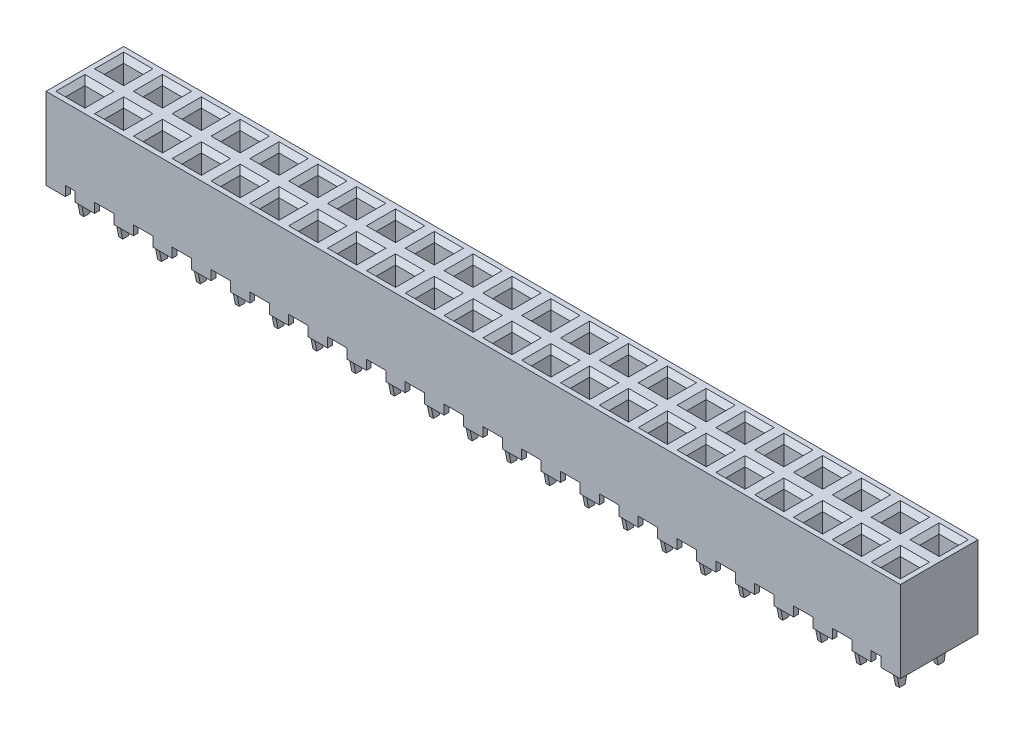
from build123d import *
from OCP.BRepFilletAPI import BRepFilletAPI_MakeChamfer

# Parameters (mm, degrees)
SKETCH1_W           = 44
SKETCH1_H           = 4
BOSS_EXTRUDE1_DEPTH = 4.2
SKETCH3_W           = 1.5
SKETCH3_H           = 1.5
CUT_EXTRUDE1_DEPTH  = 0.25
CUT_EXTRUDE1_TAPER  = 45
CUT_EXTRUDE2_DEPTH  = 0.5
SKETCH4_W           = 0.2
SKETCH4_H           = 0.5
BOSS_EXTRUDE2_DEPTH = 1.77
CHAMFER1_SIZE       = 0.5
CHAMFER1_SIZE2      = 0.1
MIRROR2_START       = -2
MIRROR2_OUTLINE_W   = 0.2
MIRROR2_OUTLINE_H   = 0.509901952
MIRROR2_DEPTH       = 0.623264731
MIRROR2_START_2     = -0.637377439
MIRROR2_2_OUTLINE_W = 0.2
MIRROR2_2_OUTLINE_H = 0.509901951
MIRROR2_2_DEPTH     = 1.221803522
SKETCH5_W           = 1
SKETCH5_H           = 1
CUT_EXTRUDE3_DEPTH  = 2


with BuildPart() as part:
    # Sketch1 → Boss-Extrude1 (new body)
    with BuildSketch(Plane(origin=(0, 0, 0), x_dir=(1, 0, 0), z_dir=(0, 1, 0))):
        Rectangle(SKETCH1_W, SKETCH1_H)
    extrude(amount=BOSS_EXTRUDE1_DEPTH)

    # Sketch3 → Cut-Extrude1 (cut)
    with BuildSketch(Plane(origin=(0, 4.2, 0), x_dir=(1, 0, 0), z_dir=(0, 1, 0))):
        with Locations((21, -1)):
            Rectangle(SKETCH3_W, SKETCH3_H)
        with Locations((19.000006605, -1)):
            Rectangle(SKETCH3_W, SKETCH3_H)
        with Locations((17.00001321, -1)):
            Rectangle(SKETCH3_W, SKETCH3_H)
        with Locations((15.000019814, -1)):
            Rectangle(SKETCH3_W, SKETCH3_H)
        with Locations((13.000026419, -1)):
            Rectangle(SKETCH3_W, SKETCH3_H)
        with Locations((11.000033024, -1)):
            Rectangle(SKETCH3_W, SKETCH3_H)
        with Locations((9.000039629, -1)):
            Rectangle(SKETCH3_W, SKETCH3_H)
        with Locations((7.000046234, -1)):
            Rectangle(SKETCH3_W, SKETCH3_H)
        with Locations((5.000052838, -1)):
            Rectangle(SKETCH3_W, SKETCH3_H)
        with Locations((3.000059443, -1)):
            Rectangle(SKETCH3_W, SKETCH3_H)
        with Locations((1.000066048, -1)):
            Rectangle(SKETCH3_W, SKETCH3_H)
        with Locations((-0.999927347, -1)):
            Rectangle(SKETCH3_W, SKETCH3_H)
        with Locations((-2.999920742, -1)):
            Rectangle(SKETCH3_W, SKETCH3_H)
        with Locations((-4.999914138, -1)):
            Rectangle(SKETCH3_W, SKETCH3_H)
        with Locations((-6.999907533, -1)):
            Rectangle(SKETCH3_W, SKETCH3_H)
        with Locations((-8.999900928, -1)):
            Rectangle(SKETCH3_W, SKETCH3_H)
        with Locations((-10.999894323, -1)):
            Rectangle(SKETCH3_W, SKETCH3_H)
        with Locations((-12.999887718, -1)):
            Rectangle(SKETCH3_W, SKETCH3_H)
        with Locations((-14.999881114, -1)):
            Rectangle(SKETCH3_W, SKETCH3_H)
        with Locations((-16.999874509, -1)):
            Rectangle(SKETCH3_W, SKETCH3_H)
        with Locations((-18.999867904, -1)):
            Rectangle(SKETCH3_W, SKETCH3_H)
        with Locations((-20.999861299, -1)):
            Rectangle(SKETCH3_W, SKETCH3_H)
        with Locations((19.000006605, 1)):
            Rectangle(SKETCH3_W, SKETCH3_H)
        with Locations((17.00001321, 1)):
            Rectangle(SKETCH3_W, SKETCH3_H)
        with Locations((15.000019814, 1)):
            Rectangle(SKETCH3_W, SKETCH3_H)
        with Locations((13.000026419, 1)):
            Rectangle(SKETCH3_W, SKETCH3_H)
        with Locations((11.000033024, 1)):
            Rectangle(SKETCH3_W, SKETCH3_H)
        with Locations((9.000039629, 1)):
            Rectangle(SKETCH3_W, SKETCH3_H)
        with Locations((7.000046234, 1)):
            Rectangle(SKETCH3_W, SKETCH3_H)
        with Locations((5.000052838, 1)):
            Rectangle(SKETCH3_W, SKETCH3_H)
        with Locations((3.000059443, 1)):
            Rectangle(SKETCH3_W, SKETCH3_H)
        with Locations((1.000066048, 1)):
            Rectangle(SKETCH3_W, SKETCH3_H)
        with Locations((-0.999927347, 1)):
            Rectangle(SKETCH3_W, SKETCH3_H)
        with Locations((-2.999920742, 1)):
            Rectangle(SKETCH3_W, SKETCH3_H)
        with Locations((-4.999914138, 1)):
            Rectangle(SKETCH3_W, SKETCH3_H)
        with Locations((-6.999907533, 1)):
            Rectangle(SKETCH3_W, SKETCH3_H)
        with Locations((-8.999900928, 1)):
            Rectangle(SKETCH3_W, SKETCH3_H)
        with Locations((-10.999894323, 1)):
            Rectangle(SKETCH3_W, SKETCH3_H)
        with Locations((-12.999887718, 1)):
            Rectangle(SKETCH3_W, SKETCH3_H)
        with Locations((-14.999881114, 1)):
            Rectangle(SKETCH3_W, SKETCH3_H)
        with Locations((-16.999874509, 1)):
            Rectangle(SKETCH3_W, SKETCH3_H)
        with Locations((-18.999867904, 1)):
            Rectangle(SKETCH3_W, SKETCH3_H)
        with Locations((-20.999861299, 1)):
            Rectangle(SKETCH3_W, SKETCH3_H)
        with Locations((21, 1)):
            Rectangle(SKETCH3_W, SKETCH3_H)
    extrude(amount=-CUT_EXTRUDE1_DEPTH, taper=CUT_EXTRUDE1_TAPER, mode=Mode.SUBTRACT)

    # Sketch2 → Cut-Extrude2 (cut)
    with BuildSketch(Plane.XZ):
        Polygon((21.75, 1.75), (21.75, -1.75), (21, -1.75), (21, -2), (20.5, -2), (20.5, -1.75), (19.5, -1.75), (19.5, -2), (18.5, -2), (18.5, -1.75), (17.5, -1.75), (17.5, -2), (16.5, -2), (16.5, -1.75), (15.5, -1.75), (15.5, -2), (14.5, -2), (14.5, -1.75), (13.5, -1.75), (13.5, -2), (12.5, -2), (12.5, -1.75), (11.5, -1.75), (11.5, -2), (10.5, -2), (10.5, -1.75), (9.5, -1.75), (9.5, -2), (8.5, -2), (8.5, -1.75), (7.5, -1.75), (7.5, -2), (6.5, -2), (6.5, -1.75), (5.5, -1.75), (5.5, -2), (4.5, -2), (4.5, -1.75), (3.5, -1.75), (3.5, -2), (2.5, -2), (2.5, -1.75), (1.5, -1.75), (1.5, -2), (0.5, -2), (0.5, -1.75), (-0.5, -1.75), (-0.5, -2), (-1.5, -2), (-1.5, -1.75), (-2.5, -1.75), (-2.5, -2), (-3.5, -2), (-3.5, -1.75), (-4.5, -1.75), (-4.5, -2), (-5.5, -2), (-5.5, -1.75), (-6.5, -1.75), (-6.5, -2), (-7.5, -2), (-7.5, -1.75), (-8.5, -1.75), (-8.5, -2), (-9.5, -2), (-9.5, -1.75), (-10.5, -1.75), (-10.5, -2), (-11.5, -2), (-11.5, -1.75), (-12.5, -1.75), (-12.5, -2), (-13.5, -2), (-13.5, -1.75), (-14.5, -1.75), (-14.5, -2), (-15.5, -2), (-15.5, -1.75), (-16.5, -1.75), (-16.5, -2), (-17.5, -2), (-17.5, -1.75), (-18.5, -1.75), (-18.5, -2), (-19.5, -2), (-19.5, -1.75), (-20.5, -1.75), (-20.5, -2), (-21, -2), (-21, -1.75), (-21.75, -1.75), (-21.75, 1.75), (-21, 1.75), (-21, 2), (-20.5, 2), (-20.5, 1.75), (-19.5, 1.75), (-19.5, 2), (-18.5, 2), (-18.5, 1.75), (-17.5, 1.75), (-17.5, 2), (-16.5, 2), (-16.5, 1.75), (-15.5, 1.75), (-15.5, 2), (-14.5, 2), (-14.5, 1.75), (-13.5, 1.75), (-13.5, 2), (-12.5, 2), (-12.5, 1.75), (-11.5, 1.75), (-11.5, 2), (-10.5, 2), (-10.5, 1.75), (-9.5, 1.75), (-9.5, 2), (-8.5, 2), (-8.5, 1.75), (-7.5, 1.75), (-7.5, 2), (-6.5, 2), (-6.5, 1.75), (-5.5, 1.75), (-5.5, 2), (-4.5, 2), (-4.5, 1.75), (-3.5, 1.75), (-3.5, 2), (-2.5, 2), (-2.5, 1.75), (-1.5, 1.75), (-1.5, 2), (-0.5, 2), (-0.5, 1.75), (0.5, 1.75), (0.5, 2), (1.5, 2), (1.5, 1.75), (2.5, 1.75), (2.5, 2), (3.5, 2), (3.5, 1.75), (4.5, 1.75), (4.5, 2), (5.5, 2), (5.5, 1.75), (6.5, 1.75), (6.5, 2), (7.5, 2), (7.5, 1.75), (8.5, 1.75), (8.5, 2), (9.5, 2), (9.5, 1.75), (10.5, 1.75), (10.5, 2), (11.5, 2), (11.5, 1.75), (12.5, 1.75), (12.5, 2), (13.5, 2), (13.5, 1.75), (14.5, 1.75), (14.5, 2), (15.5, 2), (15.5, 1.75), (16.5, 1.75), (16.5, 2), (17.5, 2), (17.5, 1.75), (18.5, 1.75), (18.5, 2), (19.5, 2), (19.5, 1.75), (20.5, 1.75), (20.5, 2), (21, 2), (21, 1.75), align=None)
    extrude(amount=-CUT_EXTRUDE2_DEPTH, mode=Mode.SUBTRACT)

    # Sketch4 → Boss-Extrude2 (add)
    with BuildSketch(Plane.XZ.offset(-0.5)):
        with Locations((21, -1)):
            Rectangle(SKETCH4_W, SKETCH4_H)
        with Locations((19.000006605, -1)):
            Rectangle(SKETCH4_W, SKETCH4_H)
        with Locations((17.00001321, -1)):
            Rectangle(SKETCH4_W, SKETCH4_H)
        with Locations((15.000019814, -1)):
            Rectangle(SKETCH4_W, SKETCH4_H)
        with Locations((13.000026419, -1)):
            Rectangle(SKETCH4_W, SKETCH4_H)
        with Locations((11.000033024, -1)):
            Rectangle(SKETCH4_W, SKETCH4_H)
        with Locations((9.000039629, -1)):
            Rectangle(SKETCH4_W, SKETCH4_H)
        with Locations((7.000046234, -1)):
            Rectangle(SKETCH4_W, SKETCH4_H)
        with Locations((5.000052838, -1)):
            Rectangle(SKETCH4_W, SKETCH4_H)
        with Locations((3.000059443, -1)):
            Rectangle(SKETCH4_W, SKETCH4_H)
        with Locations((1.000066048, -1)):
            Rectangle(SKETCH4_W, SKETCH4_H)
        with Locations((-0.999927347, -1)):
            Rectangle(SKETCH4_W, SKETCH4_H)
        with Locations((-2.999920742, -1)):
            Rectangle(SKETCH4_W, SKETCH4_H)
        with Locations((-4.999914138, -1)):
            Rectangle(SKETCH4_W, SKETCH4_H)
        with Locations((-6.999907533, -1)):
            Rectangle(SKETCH4_W, SKETCH4_H)
        with Locations((-8.999900928, -1)):
            Rectangle(SKETCH4_W, SKETCH4_H)
        with Locations((-10.999894323, -1)):
            Rectangle(SKETCH4_W, SKETCH4_H)
        with Locations((-12.999887718, -1)):
            Rectangle(SKETCH4_W, SKETCH4_H)
        with Locations((-14.999881114, -1)):
            Rectangle(SKETCH4_W, SKETCH4_H)
        with Locations((-16.999874509, -1)):
            Rectangle(SKETCH4_W, SKETCH4_H)
        with Locations((-18.999867904, -1)):
            Rectangle(SKETCH4_W, SKETCH4_H)
        with Locations((-20.999861299, -1)):
            Rectangle(SKETCH4_W, SKETCH4_H)
        with Locations((19.000006605, 1)):
            Rectangle(SKETCH4_W, SKETCH4_H)
        with Locations((17.00001321, 1)):
            Rectangle(SKETCH4_W, SKETCH4_H)
        with Locations((15.000019814, 1)):
            Rectangle(SKETCH4_W, SKETCH4_H)
        with Locations((13.000026419, 1)):
            Rectangle(SKETCH4_W, SKETCH4_H)
        with Locations((11.000033024, 1)):
            Rectangle(SKETCH4_W, SKETCH4_H)
        with Locations((9.000039629, 1)):
            Rectangle(SKETCH4_W, SKETCH4_H)
        with Locations((7.000046234, 1)):
            Rectangle(SKETCH4_W, SKETCH4_H)
        with Locations((5.000052838, 1)):
            Rectangle(SKETCH4_W, SKETCH4_H)
        with Locations((3.000059443, 1)):
            Rectangle(SKETCH4_W, SKETCH4_H)
        with Locations((1.000066048, 1)):
            Rectangle(SKETCH4_W, SKETCH4_H)
        with Locations((-0.999927347, 1)):
            Rectangle(SKETCH4_W, SKETCH4_H)
        with Locations((-2.999920742, 1)):
            Rectangle(SKETCH4_W, SKETCH4_H)
        with Locations((-4.999914138, 1)):
            Rectangle(SKETCH4_W, SKETCH4_H)
        with Locations((-6.999907533, 1)):
            Rectangle(SKETCH4_W, SKETCH4_H)
        with Locations((-8.999900928, 1)):
            Rectangle(SKETCH4_W, SKETCH4_H)
        with Locations((-10.999894323, 1)):
            Rectangle(SKETCH4_W, SKETCH4_H)
        with Locations((-12.999887718, 1)):
            Rectangle(SKETCH4_W, SKETCH4_H)
        with Locations((-14.999881114, 1)):
            Rectangle(SKETCH4_W, SKETCH4_H)
        with Locations((-16.999874509, 1)):
            Rectangle(SKETCH4_W, SKETCH4_H)
        with Locations((-18.999867904, 1)):
            Rectangle(SKETCH4_W, SKETCH4_H)
        with Locations((-20.999861299, 1)):
            Rectangle(SKETCH4_W, SKETCH4_H)
        with Locations((21, 1)):
            Rectangle(SKETCH4_W, SKETCH4_H)
    extrude(amount=BOSS_EXTRUDE2_DEPTH)

    # Chamfer1: one chamfer whose edges measure the first distance from different faces: ONE call of the kernel's chamfer builder (chamfer() names one face for all edges)
    chamfer1_edges_1 = [part.edges().sort_by_distance(p)[0] for p in [
        (21, -1.27, -0.75),
    ]]
    chamfer1_side_1 = [part.faces().sort_by_distance(p)[0] for p in [
        (21, -0.385, -0.75),
    ]]
    chamfer1_edges_2 = [part.edges().sort_by_distance(p)[0] for p in [
        (19.000006605, -1.27, -0.75),
    ]]
    chamfer1_side_2 = [part.faces().sort_by_distance(p)[0] for p in [
        (19.000006605, -0.385, -0.75),
    ]]
    chamfer1_edges_3 = [part.edges().sort_by_distance(p)[0] for p in [
        (17.00001321, -1.27, -0.75),
    ]]
    chamfer1_side_3 = [part.faces().sort_by_distance(p)[0] for p in [
        (17.00001321, -0.385, -0.75),
    ]]
    chamfer1_edges_4 = [part.edges().sort_by_distance(p)[0] for p in [
        (15.000019814, -1.27, -0.75),
    ]]
    chamfer1_side_4 = [part.faces().sort_by_distance(p)[0] for p in [
        (15.000019814, -0.385, -0.75),
    ]]
    chamfer1_edges_5 = [part.edges().sort_by_distance(p)[0] for p in [
        (13.000026419, -1.27, -0.75),
    ]]
    chamfer1_side_5 = [part.faces().sort_by_distance(p)[0] for p in [
        (13.000026419, -0.385, -0.75),
    ]]
    chamfer1_edges_6 = [part.edges().sort_by_distance(p)[0] for p in [
        (11.000033024, -1.27, -0.75),
    ]]
    chamfer1_side_6 = [part.faces().sort_by_distance(p)[0] for p in [
        (11.000033024, -0.385, -0.75),
    ]]
    chamfer1_edges_7 = [part.edges().sort_by_distance(p)[0] for p in [
        (9.000039629, -1.27, -0.75),
    ]]
    chamfer1_side_7 = [part.faces().sort_by_distance(p)[0] for p in [
        (9.000039629, -0.385, -0.75),
    ]]
    chamfer1_edges_8 = [part.edges().sort_by_distance(p)[0] for p in [
        (7.000046234, -1.27, -0.75),
    ]]
    chamfer1_side_8 = [part.faces().sort_by_distance(p)[0] for p in [
        (7.000046234, -0.385, -0.75),
    ]]
    chamfer1_edges_9 = [part.edges().sort_by_distance(p)[0] for p in [
        (5.000052838, -1.27, -0.75),
    ]]
    chamfer1_side_9 = [part.faces().sort_by_distance(p)[0] for p in [
        (5.000052838, -0.385, -0.75),
    ]]
    chamfer1_edges_10 = [part.edges().sort_by_distance(p)[0] for p in [
        (3.000059443, -1.27, -0.75),
    ]]
    chamfer1_side_10 = [part.faces().sort_by_distance(p)[0] for p in [
        (3.000059443, -0.385, -0.75),
    ]]
    chamfer1_edges_11 = [part.edges().sort_by_distance(p)[0] for p in [
        (1.000066048, -1.27, -0.75),
    ]]
    chamfer1_side_11 = [part.faces().sort_by_distance(p)[0] for p in [
        (1.000066048, -0.385, -0.75),
    ]]
    chamfer1_edges_12 = [part.edges().sort_by_distance(p)[0] for p in [
        (-0.999927347, -1.27, -0.75),
    ]]
    chamfer1_side_12 = [part.faces().sort_by_distance(p)[0] for p in [
        (-0.999927347, -0.385, -0.75),
    ]]
    chamfer1_edges_13 = [part.edges().sort_by_distance(p)[0] for p in [
        (-2.999920742, -1.27, -0.75),
    ]]
    chamfer1_side_13 = [part.faces().sort_by_distance(p)[0] for p in [
        (-2.999920742, -0.385, -0.75),
    ]]
    chamfer1_edges_14 = [part.edges().sort_by_distance(p)[0] for p in [
        (-4.999914138, -1.27, -0.75),
    ]]
    chamfer1_side_14 = [part.faces().sort_by_distance(p)[0] for p in [
        (-4.999914138, -0.385, -0.75),
    ]]
    chamfer1_edges_15 = [part.edges().sort_by_distance(p)[0] for p in [
        (-6.999907533, -1.27, -0.75),
    ]]
    chamfer1_side_15 = [part.faces().sort_by_distance(p)[0] for p in [
        (-6.999907533, -0.385, -0.75),
    ]]
    chamfer1_edges_16 = [part.edges().sort_by_distance(p)[0] for p in [
        (-8.999900928, -1.27, -0.75),
    ]]
    chamfer1_side_16 = [part.faces().sort_by_distance(p)[0] for p in [
        (-8.999900928, -0.385, -0.75),
    ]]
    chamfer1_edges_17 = [part.edges().sort_by_distance(p)[0] for p in [
        (-10.999894323, -1.27, -0.75),
    ]]
    chamfer1_side_17 = [part.faces().sort_by_distance(p)[0] for p in [
        (-10.999894323, -0.385, -0.75),
    ]]
    chamfer1_edges_18 = [part.edges().sort_by_distance(p)[0] for p in [
        (-12.999887718, -1.27, -0.75),
    ]]
    chamfer1_side_18 = [part.faces().sort_by_distance(p)[0] for p in [
        (-12.999887718, -0.385, -0.75),
    ]]
    chamfer1_edges_19 = [part.edges().sort_by_distance(p)[0] for p in [
        (-14.999881114, -1.27, -0.75),
    ]]
    chamfer1_side_19 = [part.faces().sort_by_distance(p)[0] for p in [
        (-14.999881114, -0.385, -0.75),
    ]]
    chamfer1_edges_20 = [part.edges().sort_by_distance(p)[0] for p in [
        (-16.999874509, -1.27, -0.75),
    ]]
    chamfer1_side_20 = [part.faces().sort_by_distance(p)[0] for p in [
        (-16.999874509, -0.385, -0.75),
    ]]
    chamfer1_edges_21 = [part.edges().sort_by_distance(p)[0] for p in [
        (-18.999867904, -1.27, -0.75),
    ]]
    chamfer1_side_21 = [part.faces().sort_by_distance(p)[0] for p in [
        (-18.999867904, -0.385, -0.75),
    ]]
    chamfer1_edges_22 = [part.edges().sort_by_distance(p)[0] for p in [
        (-20.999861299, -1.27, -0.75),
    ]]
    chamfer1_side_22 = [part.faces().sort_by_distance(p)[0] for p in [
        (-20.999861299, -0.385, -0.75),
    ]]
    chamfer1_edges_23 = [part.edges().sort_by_distance(p)[0] for p in [
        (19.000006605, -1.27, 1.25),
    ]]
    chamfer1_side_23 = [part.faces().sort_by_distance(p)[0] for p in [
        (19.000006605, -0.385, 1.25),
    ]]
    chamfer1_edges_24 = [part.edges().sort_by_distance(p)[0] for p in [
        (17.00001321, -1.27, 1.25),
    ]]
    chamfer1_side_24 = [part.faces().sort_by_distance(p)[0] for p in [
        (17.00001321, -0.385, 1.25),
    ]]
    chamfer1_edges_25 = [part.edges().sort_by_distance(p)[0] for p in [
        (15.000019814, -1.27, 1.25),
    ]]
    chamfer1_side_25 = [part.faces().sort_by_distance(p)[0] for p in [
        (15.000019814, -0.385, 1.25),
    ]]
    chamfer1_edges_26 = [part.edges().sort_by_distance(p)[0] for p in [
        (13.000026419, -1.27, 1.25),
    ]]
    chamfer1_side_26 = [part.faces().sort_by_distance(p)[0] for p in [
        (13.000026419, -0.385, 1.25),
    ]]
    chamfer1_edges_27 = [part.edges().sort_by_distance(p)[0] for p in [
        (11.000033024, -1.27, 1.25),
    ]]
    chamfer1_side_27 = [part.faces().sort_by_distance(p)[0] for p in [
        (11.000033024, -0.385, 1.25),
    ]]
    chamfer1_edges_28 = [part.edges().sort_by_distance(p)[0] for p in [
        (9.000039629, -1.27, 1.25),
    ]]
    chamfer1_side_28 = [part.faces().sort_by_distance(p)[0] for p in [
        (9.000039629, -0.385, 1.25),
    ]]
    chamfer1_edges_29 = [part.edges().sort_by_distance(p)[0] for p in [
        (7.000046234, -1.27, 1.25),
    ]]
    chamfer1_side_29 = [part.faces().sort_by_distance(p)[0] for p in [
        (7.000046234, -0.385, 1.25),
    ]]
    chamfer1_edges_30 = [part.edges().sort_by_distance(p)[0] for p in [
        (5.000052838, -1.27, 1.25),
    ]]
    chamfer1_side_30 = [part.faces().sort_by_distance(p)[0] for p in [
        (5.000052838, -0.385, 1.25),
    ]]
    chamfer1_edges_31 = [part.edges().sort_by_distance(p)[0] for p in [
        (3.000059443, -1.27, 1.25),
    ]]
    chamfer1_side_31 = [part.faces().sort_by_distance(p)[0] for p in [
        (3.000059443, -0.385, 1.25),
    ]]
    chamfer1_edges_32 = [part.edges().sort_by_distance(p)[0] for p in [
        (1.000066048, -1.27, 1.25),
    ]]
    chamfer1_side_32 = [part.faces().sort_by_distance(p)[0] for p in [
        (1.000066048, -0.385, 1.25),
    ]]
    chamfer1_edges_33 = [part.edges().sort_by_distance(p)[0] for p in [
        (-0.999927347, -1.27, 1.25),
    ]]
    chamfer1_side_33 = [part.faces().sort_by_distance(p)[0] for p in [
        (-0.999927347, -0.385, 1.25),
    ]]
    chamfer1_edges_34 = [part.edges().sort_by_distance(p)[0] for p in [
        (-2.999920742, -1.27, 1.25),
    ]]
    chamfer1_side_34 = [part.faces().sort_by_distance(p)[0] for p in [
        (-2.999920742, -0.385, 1.25),
    ]]
    chamfer1_edges_35 = [part.edges().sort_by_distance(p)[0] for p in [
        (-4.999914138, -1.27, 1.25),
    ]]
    chamfer1_side_35 = [part.faces().sort_by_distance(p)[0] for p in [
        (-4.999914138, -0.385, 1.25),
    ]]
    chamfer1_edges_36 = [part.edges().sort_by_distance(p)[0] for p in [
        (-6.999907533, -1.27, 1.25),
    ]]
    chamfer1_side_36 = [part.faces().sort_by_distance(p)[0] for p in [
        (-6.999907533, -0.385, 1.25),
    ]]
    chamfer1_edges_37 = [part.edges().sort_by_distance(p)[0] for p in [
        (-8.999900928, -1.27, 1.25),
    ]]
    chamfer1_side_37 = [part.faces().sort_by_distance(p)[0] for p in [
        (-8.999900928, -0.385, 1.25),
    ]]
    chamfer1_edges_38 = [part.edges().sort_by_distance(p)[0] for p in [
        (-10.999894323, -1.27, 1.25),
    ]]
    chamfer1_side_38 = [part.faces().sort_by_distance(p)[0] for p in [
        (-10.999894323, -0.385, 1.25),
    ]]
    chamfer1_edges_39 = [part.edges().sort_by_distance(p)[0] for p in [
        (-12.999887718, -1.27, 1.25),
    ]]
    chamfer1_side_39 = [part.faces().sort_by_distance(p)[0] for p in [
        (-12.999887718, -0.385, 1.25),
    ]]
    chamfer1_edges_40 = [part.edges().sort_by_distance(p)[0] for p in [
        (-14.999881114, -1.27, 1.25),
    ]]
    chamfer1_side_40 = [part.faces().sort_by_distance(p)[0] for p in [
        (-14.999881114, -0.385, 1.25),
    ]]
    chamfer1_edges_41 = [part.edges().sort_by_distance(p)[0] for p in [
        (-16.999874509, -1.27, 1.25),
    ]]
    chamfer1_side_41 = [part.faces().sort_by_distance(p)[0] for p in [
        (-16.999874509, -0.385, 1.25),
    ]]
    chamfer1_edges_42 = [part.edges().sort_by_distance(p)[0] for p in [
        (-18.999867904, -1.27, 1.25),
    ]]
    chamfer1_side_42 = [part.faces().sort_by_distance(p)[0] for p in [
        (-18.999867904, -0.385, 1.25),
    ]]
    chamfer1_edges_43 = [part.edges().sort_by_distance(p)[0] for p in [
        (-20.999861299, -1.27, 1.25),
    ]]
    chamfer1_side_43 = [part.faces().sort_by_distance(p)[0] for p in [
        (-20.999861299, -0.385, 1.25),
    ]]
    chamfer1_edges_44 = [part.edges().sort_by_distance(p)[0] for p in [
        (21, -1.27, 1.25),
    ]]
    chamfer1_side_44 = [part.faces().sort_by_distance(p)[0] for p in [
        (21, -0.385, 1.25),
    ]]
    chamfer1 = BRepFilletAPI_MakeChamfer(part.part.solid().wrapped)
    for e in chamfer1_edges_1:
        chamfer1.Add(CHAMFER1_SIZE, CHAMFER1_SIZE2, e.wrapped, chamfer1_side_1[0].wrapped)  # the first distance lies on this face
    for e in chamfer1_edges_2:
        chamfer1.Add(CHAMFER1_SIZE, CHAMFER1_SIZE2, e.wrapped, chamfer1_side_2[0].wrapped)  # the first distance lies on this face
    for e in chamfer1_edges_3:
        chamfer1.Add(CHAMFER1_SIZE, CHAMFER1_SIZE2, e.wrapped, chamfer1_side_3[0].wrapped)  # the first distance lies on this face
    for e in chamfer1_edges_4:
        chamfer1.Add(CHAMFER1_SIZE, CHAMFER1_SIZE2, e.wrapped, chamfer1_side_4[0].wrapped)  # the first distance lies on this face
    for e in chamfer1_edges_5:
        chamfer1.Add(CHAMFER1_SIZE, CHAMFER1_SIZE2, e.wrapped, chamfer1_side_5[0].wrapped)  # the first distance lies on this face
    for e in chamfer1_edges_6:
        chamfer1.Add(CHAMFER1_SIZE, CHAMFER1_SIZE2, e.wrapped, chamfer1_side_6[0].wrapped)  # the first distance lies on this face
    for e in chamfer1_edges_7:
        chamfer1.Add(CHAMFER1_SIZE, CHAMFER1_SIZE2, e.wrapped, chamfer1_side_7[0].wrapped)  # the first distance lies on this face
    for e in chamfer1_edges_8:
        chamfer1.Add(CHAMFER1_SIZE, CHAMFER1_SIZE2, e.wrapped, chamfer1_side_8[0].wrapped)  # the first distance lies on this face
    for e in chamfer1_edges_9:
        chamfer1.Add(CHAMFER1_SIZE, CHAMFER1_SIZE2, e.wrapped, chamfer1_side_9[0].wrapped)  # the first distance lies on this face
    for e in chamfer1_edges_10:
        chamfer1.Add(CHAMFER1_SIZE, CHAMFER1_SIZE2, e.wrapped, chamfer1_side_10[0].wrapped)  # the first distance lies on this face
    for e in chamfer1_edges_11:
        chamfer1.Add(CHAMFER1_SIZE, CHAMFER1_SIZE2, e.wrapped, chamfer1_side_11[0].wrapped)  # the first distance lies on this face
    for e in chamfer1_edges_12:
        chamfer1.Add(CHAMFER1_SIZE, CHAMFER1_SIZE2, e.wrapped, chamfer1_side_12[0].wrapped)  # the first distance lies on this face
    for e in chamfer1_edges_13:
        chamfer1.Add(CHAMFER1_SIZE, CHAMFER1_SIZE2, e.wrapped, chamfer1_side_13[0].wrapped)  # the first distance lies on this face
    for e in chamfer1_edges_14:
        chamfer1.Add(CHAMFER1_SIZE, CHAMFER1_SIZE2, e.wrapped, chamfer1_side_14[0].wrapped)  # the first distance lies on this face
    for e in chamfer1_edges_15:
        chamfer1.Add(CHAMFER1_SIZE, CHAMFER1_SIZE2, e.wrapped, chamfer1_side_15[0].wrapped)  # the first distance lies on this face
    for e in chamfer1_edges_16:
        chamfer1.Add(CHAMFER1_SIZE, CHAMFER1_SIZE2, e.wrapped, chamfer1_side_16[0].wrapped)  # the first distance lies on this face
    for e in chamfer1_edges_17:
        chamfer1.Add(CHAMFER1_SIZE, CHAMFER1_SIZE2, e.wrapped, chamfer1_side_17[0].wrapped)  # the first distance lies on this face
    for e in chamfer1_edges_18:
        chamfer1.Add(CHAMFER1_SIZE, CHAMFER1_SIZE2, e.wrapped, chamfer1_side_18[0].wrapped)  # the first distance lies on this face
    for e in chamfer1_edges_19:
        chamfer1.Add(CHAMFER1_SIZE, CHAMFER1_SIZE2, e.wrapped, chamfer1_side_19[0].wrapped)  # the first distance lies on this face
    for e in chamfer1_edges_20:
        chamfer1.Add(CHAMFER1_SIZE, CHAMFER1_SIZE2, e.wrapped, chamfer1_side_20[0].wrapped)  # the first distance lies on this face
    for e in chamfer1_edges_21:
        chamfer1.Add(CHAMFER1_SIZE, CHAMFER1_SIZE2, e.wrapped, chamfer1_side_21[0].wrapped)  # the first distance lies on this face
    for e in chamfer1_edges_22:
        chamfer1.Add(CHAMFER1_SIZE, CHAMFER1_SIZE2, e.wrapped, chamfer1_side_22[0].wrapped)  # the first distance lies on this face
    for e in chamfer1_edges_23:
        chamfer1.Add(CHAMFER1_SIZE, CHAMFER1_SIZE2, e.wrapped, chamfer1_side_23[0].wrapped)  # the first distance lies on this face
    for e in chamfer1_edges_24:
        chamfer1.Add(CHAMFER1_SIZE, CHAMFER1_SIZE2, e.wrapped, chamfer1_side_24[0].wrapped)  # the first distance lies on this face
    for e in chamfer1_edges_25:
        chamfer1.Add(CHAMFER1_SIZE, CHAMFER1_SIZE2, e.wrapped, chamfer1_side_25[0].wrapped)  # the first distance lies on this face
    for e in chamfer1_edges_26:
        chamfer1.Add(CHAMFER1_SIZE, CHAMFER1_SIZE2, e.wrapped, chamfer1_side_26[0].wrapped)  # the first distance lies on this face
    for e in chamfer1_edges_27:
        chamfer1.Add(CHAMFER1_SIZE, CHAMFER1_SIZE2, e.wrapped, chamfer1_side_27[0].wrapped)  # the first distance lies on this face
    for e in chamfer1_edges_28:
        chamfer1.Add(CHAMFER1_SIZE, CHAMFER1_SIZE2, e.wrapped, chamfer1_side_28[0].wrapped)  # the first distance lies on this face
    for e in chamfer1_edges_29:
        chamfer1.Add(CHAMFER1_SIZE, CHAMFER1_SIZE2, e.wrapped, chamfer1_side_29[0].wrapped)  # the first distance lies on this face
    for e in chamfer1_edges_30:
        chamfer1.Add(CHAMFER1_SIZE, CHAMFER1_SIZE2, e.wrapped, chamfer1_side_30[0].wrapped)  # the first distance lies on this face
    for e in chamfer1_edges_31:
        chamfer1.Add(CHAMFER1_SIZE, CHAMFER1_SIZE2, e.wrapped, chamfer1_side_31[0].wrapped)  # the first distance lies on this face
    for e in chamfer1_edges_32:
        chamfer1.Add(CHAMFER1_SIZE, CHAMFER1_SIZE2, e.wrapped, chamfer1_side_32[0].wrapped)  # the first distance lies on this face
    for e in chamfer1_edges_33:
        chamfer1.Add(CHAMFER1_SIZE, CHAMFER1_SIZE2, e.wrapped, chamfer1_side_33[0].wrapped)  # the first distance lies on this face
    for e in chamfer1_edges_34:
        chamfer1.Add(CHAMFER1_SIZE, CHAMFER1_SIZE2, e.wrapped, chamfer1_side_34[0].wrapped)  # the first distance lies on this face
    for e in chamfer1_edges_35:
        chamfer1.Add(CHAMFER1_SIZE, CHAMFER1_SIZE2, e.wrapped, chamfer1_side_35[0].wrapped)  # the first distance lies on this face
    for e in chamfer1_edges_36:
        chamfer1.Add(CHAMFER1_SIZE, CHAMFER1_SIZE2, e.wrapped, chamfer1_side_36[0].wrapped)  # the first distance lies on this face
    for e in chamfer1_edges_37:
        chamfer1.Add(CHAMFER1_SIZE, CHAMFER1_SIZE2, e.wrapped, chamfer1_side_37[0].wrapped)  # the first distance lies on this face
    for e in chamfer1_edges_38:
        chamfer1.Add(CHAMFER1_SIZE, CHAMFER1_SIZE2, e.wrapped, chamfer1_side_38[0].wrapped)  # the first distance lies on this face
    for e in chamfer1_edges_39:
        chamfer1.Add(CHAMFER1_SIZE, CHAMFER1_SIZE2, e.wrapped, chamfer1_side_39[0].wrapped)  # the first distance lies on this face
    for e in chamfer1_edges_40:
        chamfer1.Add(CHAMFER1_SIZE, CHAMFER1_SIZE2, e.wrapped, chamfer1_side_40[0].wrapped)  # the first distance lies on this face
    for e in chamfer1_edges_41:
        chamfer1.Add(CHAMFER1_SIZE, CHAMFER1_SIZE2, e.wrapped, chamfer1_side_41[0].wrapped)  # the first distance lies on this face
    for e in chamfer1_edges_42:
        chamfer1.Add(CHAMFER1_SIZE, CHAMFER1_SIZE2, e.wrapped, chamfer1_side_42[0].wrapped)  # the first distance lies on this face
    for e in chamfer1_edges_43:
        chamfer1.Add(CHAMFER1_SIZE, CHAMFER1_SIZE2, e.wrapped, chamfer1_side_43[0].wrapped)  # the first distance lies on this face
    for e in chamfer1_edges_44:
        chamfer1.Add(CHAMFER1_SIZE, CHAMFER1_SIZE2, e.wrapped, chamfer1_side_44[0].wrapped)  # the first distance lies on this face
    add(Compound.cast(chamfer1.Shape()), mode=Mode.REPLACE)

    # Mirror2: read off the stored shape, not the designer's step
    # Mirror2 outline → Mirror2 (cut)
    with BuildSketch(Plane(origin=(0, 0, 0), x_dir=(1, 0, 0), z_dir=(0, 0.19611613513818094, 0.9805806756909208)).offset(MIRROR2_START)):
        with Locations((21, -0.764852927)):
            Rectangle(MIRROR2_OUTLINE_W, MIRROR2_OUTLINE_H)
        with Locations((-20.999861299, -0.764852927)):
            Rectangle(MIRROR2_OUTLINE_W, MIRROR2_OUTLINE_H)
        with Locations((-18.999867904, -0.764852927)):
            Rectangle(MIRROR2_OUTLINE_W, MIRROR2_OUTLINE_H)
        with Locations((-16.999874509, -0.764852927)):
            Rectangle(MIRROR2_OUTLINE_W, MIRROR2_OUTLINE_H)
        with Locations((-14.999881114, -0.764852927)):
            Rectangle(MIRROR2_OUTLINE_W, MIRROR2_OUTLINE_H)
        with Locations((-12.999887718, -0.764852927)):
            Rectangle(MIRROR2_OUTLINE_W, MIRROR2_OUTLINE_H)
        with Locations((-10.999894323, -0.764852927)):
            Rectangle(MIRROR2_OUTLINE_W, MIRROR2_OUTLINE_H)
        with Locations((-8.999900928, -0.764852927)):
            Rectangle(MIRROR2_OUTLINE_W, MIRROR2_OUTLINE_H)
        with Locations((-6.999907533, -0.764852927)):
            Rectangle(MIRROR2_OUTLINE_W, MIRROR2_OUTLINE_H)
        with Locations((-4.999914138, -0.764852927)):
            Rectangle(MIRROR2_OUTLINE_W, MIRROR2_OUTLINE_H)
        with Locations((-2.999920742, -0.764852927)):
            Rectangle(MIRROR2_OUTLINE_W, MIRROR2_OUTLINE_H)
        with Locations((-0.999927347, -0.764852927)):
            Rectangle(MIRROR2_OUTLINE_W, MIRROR2_OUTLINE_H)
        with Locations((1.000066048, -0.764852927)):
            Rectangle(MIRROR2_OUTLINE_W, MIRROR2_OUTLINE_H)
        with Locations((3.000059443, -0.764852927)):
            Rectangle(MIRROR2_OUTLINE_W, MIRROR2_OUTLINE_H)
        with Locations((5.000052838, -0.764852927)):
            Rectangle(MIRROR2_OUTLINE_W, MIRROR2_OUTLINE_H)
        with Locations((7.000046234, -0.764852927)):
            Rectangle(MIRROR2_OUTLINE_W, MIRROR2_OUTLINE_H)
        with Locations((9.000039629, -0.764852927)):
            Rectangle(MIRROR2_OUTLINE_W, MIRROR2_OUTLINE_H)
        with Locations((11.000033024, -0.764852927)):
            Rectangle(MIRROR2_OUTLINE_W, MIRROR2_OUTLINE_H)
        with Locations((13.000026419, -0.764852927)):
            Rectangle(MIRROR2_OUTLINE_W, MIRROR2_OUTLINE_H)
        with Locations((15.000019814, -0.764852927)):
            Rectangle(MIRROR2_OUTLINE_W, MIRROR2_OUTLINE_H)
        with Locations((17.00001321, -0.764852927)):
            Rectangle(MIRROR2_OUTLINE_W, MIRROR2_OUTLINE_H)
        with Locations((19.000006605, -0.764852927)):
            Rectangle(MIRROR2_OUTLINE_W, MIRROR2_OUTLINE_H)
    extrude(amount=MIRROR2_DEPTH, mode=Mode.SUBTRACT)

    # Mirror2 2 outline → Mirror2 2 (cut)
    with BuildSketch(Plane(origin=(0, 0, 0), x_dir=(1, 0, 0), z_dir=(0, 0.19611613513818094, 0.9805806756909208)).offset(MIRROR2_START_2)):
        with Locations((21, -1.157085198)):
            Rectangle(MIRROR2_2_OUTLINE_W, MIRROR2_2_OUTLINE_H)
        with Locations((-20.999861299, -1.157085198)):
            Rectangle(MIRROR2_2_OUTLINE_W, MIRROR2_2_OUTLINE_H)
        with Locations((-18.999867904, -1.157085198)):
            Rectangle(MIRROR2_2_OUTLINE_W, MIRROR2_2_OUTLINE_H)
        with Locations((-16.999874509, -1.157085198)):
            Rectangle(MIRROR2_2_OUTLINE_W, MIRROR2_2_OUTLINE_H)
        with Locations((-14.999881114, -1.157085198)):
            Rectangle(MIRROR2_2_OUTLINE_W, MIRROR2_2_OUTLINE_H)
        with Locations((-12.999887718, -1.157085198)):
            Rectangle(MIRROR2_2_OUTLINE_W, MIRROR2_2_OUTLINE_H)
        with Locations((-10.999894323, -1.157085198)):
            Rectangle(MIRROR2_2_OUTLINE_W, MIRROR2_2_OUTLINE_H)
        with Locations((-8.999900928, -1.157085198)):
            Rectangle(MIRROR2_2_OUTLINE_W, MIRROR2_2_OUTLINE_H)
        with Locations((-6.999907533, -1.157085198)):
            Rectangle(MIRROR2_2_OUTLINE_W, MIRROR2_2_OUTLINE_H)
        with Locations((-4.999914138, -1.157085198)):
            Rectangle(MIRROR2_2_OUTLINE_W, MIRROR2_2_OUTLINE_H)
        with Locations((-2.999920742, -1.157085198)):
            Rectangle(MIRROR2_2_OUTLINE_W, MIRROR2_2_OUTLINE_H)
        with Locations((-0.999927347, -1.157085198)):
            Rectangle(MIRROR2_2_OUTLINE_W, MIRROR2_2_OUTLINE_H)
        with Locations((1.000066048, -1.157085198)):
            Rectangle(MIRROR2_2_OUTLINE_W, MIRROR2_2_OUTLINE_H)
        with Locations((3.000059443, -1.157085198)):
            Rectangle(MIRROR2_2_OUTLINE_W, MIRROR2_2_OUTLINE_H)
        with Locations((5.000052838, -1.157085198)):
            Rectangle(MIRROR2_2_OUTLINE_W, MIRROR2_2_OUTLINE_H)
        with Locations((7.000046234, -1.157085198)):
            Rectangle(MIRROR2_2_OUTLINE_W, MIRROR2_2_OUTLINE_H)
        with Locations((9.000039629, -1.157085198)):
            Rectangle(MIRROR2_2_OUTLINE_W, MIRROR2_2_OUTLINE_H)
        with Locations((11.000033024, -1.157085198)):
            Rectangle(MIRROR2_2_OUTLINE_W, MIRROR2_2_OUTLINE_H)
        with Locations((13.000026419, -1.157085198)):
            Rectangle(MIRROR2_2_OUTLINE_W, MIRROR2_2_OUTLINE_H)
        with Locations((15.000019814, -1.157085198)):
            Rectangle(MIRROR2_2_OUTLINE_W, MIRROR2_2_OUTLINE_H)
        with Locations((17.00001321, -1.157085198)):
            Rectangle(MIRROR2_2_OUTLINE_W, MIRROR2_2_OUTLINE_H)
        with Locations((19.000006605, -1.157085198)):
            Rectangle(MIRROR2_2_OUTLINE_W, MIRROR2_2_OUTLINE_H)
    extrude(amount=MIRROR2_2_DEPTH, mode=Mode.SUBTRACT)

    # Sketch5 → Cut-Extrude3 (cut)
    with BuildSketch(Plane(origin=(0, 3.95, 0), x_dir=(1, 0, 0), z_dir=(0, 1, 0))):
        with Locations((-20.999861299, 1)):
            Rectangle(SKETCH5_W, SKETCH5_H)
        with Locations((-20.999861299, -1)):
            Rectangle(SKETCH5_W, SKETCH5_H)
        with Locations((-18.999867904, -1)):
            Rectangle(SKETCH5_W, SKETCH5_H)
        with Locations((-18.999867904, 1)):
            Rectangle(SKETCH5_W, SKETCH5_H)
        with Locations((-16.999874509, 1)):
            Rectangle(SKETCH5_W, SKETCH5_H)
        with Locations((-16.999874509, -1)):
            Rectangle(SKETCH5_W, SKETCH5_H)
        with Locations((-14.999881114, 1)):
            Rectangle(SKETCH5_W, SKETCH5_H)
        with Locations((-14.999881114, -1)):
            Rectangle(SKETCH5_W, SKETCH5_H)
        with Locations((-12.999887718, 1)):
            Rectangle(SKETCH5_W, SKETCH5_H)
        with Locations((-12.999887718, -1)):
            Rectangle(SKETCH5_W, SKETCH5_H)
        with Locations((-10.999894323, 1)):
            Rectangle(SKETCH5_W, SKETCH5_H)
        with Locations((-10.999894323, -1)):
            Rectangle(SKETCH5_W, SKETCH5_H)
        with Locations((-8.999900928, 1)):
            Rectangle(SKETCH5_W, SKETCH5_H)
        with Locations((-6.999907533, 1)):
            Rectangle(SKETCH5_W, SKETCH5_H)
        with Locations((-4.999914138, 1)):
            Rectangle(SKETCH5_W, SKETCH5_H)
        with Locations((-2.999920742, 1)):
            Rectangle(SKETCH5_W, SKETCH5_H)
        with Locations((-0.999927347, 1)):
            Rectangle(SKETCH5_W, SKETCH5_H)
        with Locations((1.000066048, 1)):
            Rectangle(SKETCH5_W, SKETCH5_H)
        with Locations((3.000059443, 1)):
            Rectangle(SKETCH5_W, SKETCH5_H)
        with Locations((5.000052838, 1)):
            Rectangle(SKETCH5_W, SKETCH5_H)
        with Locations((7.000046234, 1)):
            Rectangle(SKETCH5_W, SKETCH5_H)
        with Locations((9.000039629, 1)):
            Rectangle(SKETCH5_W, SKETCH5_H)
        with Locations((11.000033024, 1)):
            Rectangle(SKETCH5_W, SKETCH5_H)
        with Locations((13.000026419, 1)):
            Rectangle(SKETCH5_W, SKETCH5_H)
        with Locations((15.000019814, 1)):
            Rectangle(SKETCH5_W, SKETCH5_H)
        with Locations((17.00001321, 1)):
            Rectangle(SKETCH5_W, SKETCH5_H)
        with Locations((19.000006605, 1)):
            Rectangle(SKETCH5_W, SKETCH5_H)
        with Locations((21, 1)):
            Rectangle(SKETCH5_W, SKETCH5_H)
        with Locations((21, -1)):
            Rectangle(SKETCH5_W, SKETCH5_H)
        with Locations((19.000006605, -1)):
            Rectangle(SKETCH5_W, SKETCH5_H)
        with Locations((17.00001321, -1)):
            Rectangle(SKETCH5_W, SKETCH5_H)
        with Locations((15.000019814, -1)):
            Rectangle(SKETCH5_W, SKETCH5_H)
        with Locations((13.000026419, -1)):
            Rectangle(SKETCH5_W, SKETCH5_H)
        with Locations((11.000033024, -1)):
            Rectangle(SKETCH5_W, SKETCH5_H)
        with Locations((9.000039629, -1)):
            Rectangle(SKETCH5_W, SKETCH5_H)
        with Locations((7.000046234, -1)):
            Rectangle(SKETCH5_W, SKETCH5_H)
        with Locations((5.000052838, -1)):
            Rectangle(SKETCH5_W, SKETCH5_H)
        with Locations((3.000059443, -1)):
            Rectangle(SKETCH5_W, SKETCH5_H)
        with Locations((1.000066048, -1)):
            Rectangle(SKETCH5_W, SKETCH5_H)
        with Locations((-0.999927347, -1)):
            Rectangle(SKETCH5_W, SKETCH5_H)
        with Locations((-2.999920742, -1)):
            Rectangle(SKETCH5_W, SKETCH5_H)
        with Locations((-4.999914138, -1)):
            Rectangle(SKETCH5_W, SKETCH5_H)
        with Locations((-6.999907533, -1)):
            Rectangle(SKETCH5_W, SKETCH5_H)
        with Locations((-8.999900928, -1)):
            Rectangle(SKETCH5_W, SKETCH5_H)
    extrude(amount=-CUT_EXTRUDE3_DEPTH, mode=Mode.SUBTRACT)


solid = part.part
